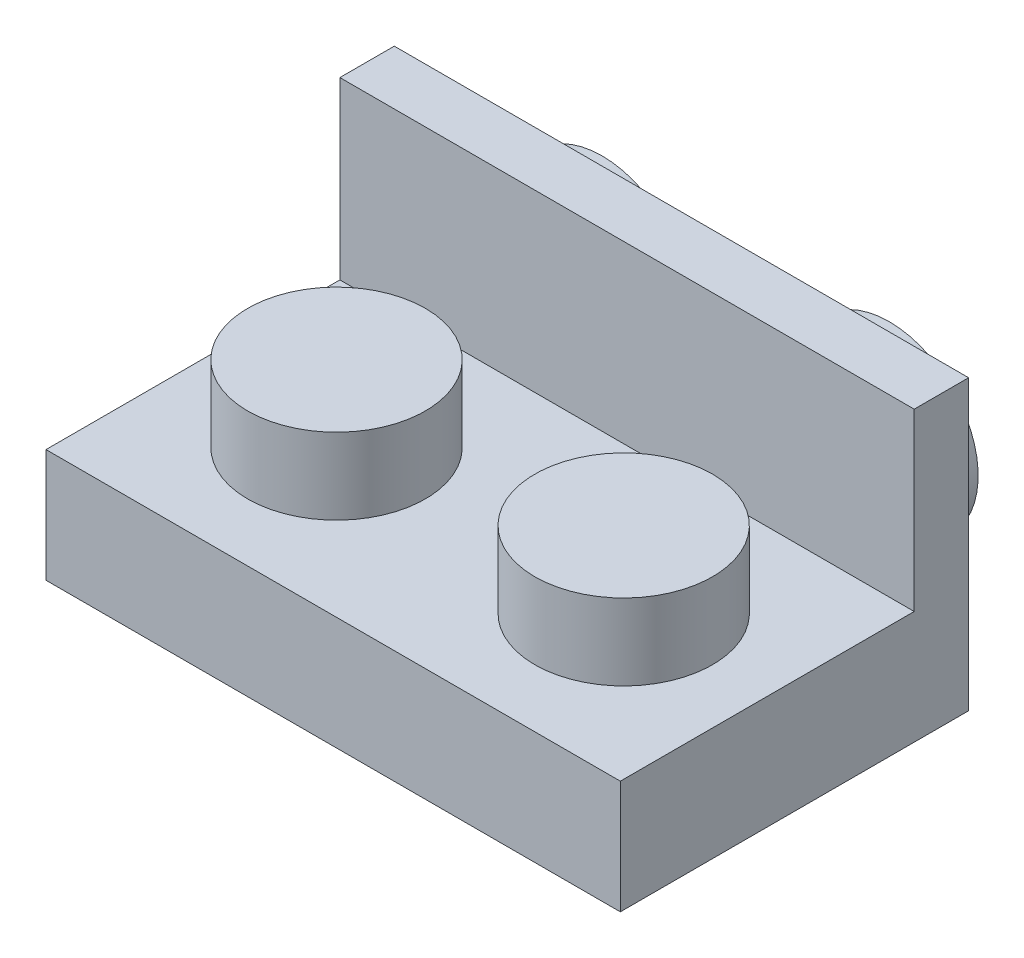
from build123d import *

# Parameters (mm, degrees)
BOSS_EXTRUDE1_DEPTH = 15.83
SKETCH2_R           = 2.45
BOSS_EXTRUDE2_DEPTH = 2.1
SHELL1_START        = -3.12
SHELL1_OUTLINE_W    = 12.83
SHELL1_OUTLINE_H    = 6.6
SHELL1_DEPTH        = 1.62
SHELL1_START_2      = -1.5
SHELL1_2_OUTLINE_R  = 0.95
SHELL1_2_DEPTH      = 2.1
SKETCH3_R           = 2.45
SKETCH3_R_2         = 1.47
SKETCH3_R_3         = 1.51
BOSS_EXTRUDE3_DEPTH = 1.77
SKETCH4_R           = 1.5
SKETCH4_R_2         = 0.66
BOSS_EXTRUDE4_DEPTH = 1.42


# Read off the part's stored shape, not the designer's step: Shell1
with BuildPart() as part:
    # Sketch1 → Boss-Extrude1 (new body)
    with BuildSketch(Plane(origin=(0, 0, 0), x_dir=(0, 0, -1), z_dir=(1, 0, 0))):
        Polygon((0, 0), (0, 4.83), (1.5, 4.83), (1.5, -3.12), (-8.1, -3.12), (-8.1, 0), align=None)
    extrude(amount=-BOSS_EXTRUDE1_DEPTH)

    # Sketch2 → Boss-Extrude2 (add)
    with BuildSketch(Plane(origin=(0, 0, 0), x_dir=(1, 0, 0), z_dir=(0, 1, 0))):
        with Locations(Location((-11.8725, -4.05, 0), (0, 0, 270))):
            Circle(SKETCH2_R)
        with Locations(Location((-3.9575, -4.05, 0), (0, 0, 270))):
            Circle(SKETCH2_R)
    extrude(amount=BOSS_EXTRUDE2_DEPTH)

    # Shell1 outline → Shell1 (cut)
    with BuildSketch(Plane(origin=(0, 0, 0), x_dir=(1, 0, 0), z_dir=(0, 1, 0)).offset(SHELL1_START)):
        with Locations((-7.915, -3.3)):
            Rectangle(SHELL1_OUTLINE_W, SHELL1_OUTLINE_H)
    extrude(amount=SHELL1_DEPTH, mode=Mode.SUBTRACT)

    # Shell1 2 outline → Shell1 2 (cut)
    with BuildSketch(Plane(origin=(0, 0, 0), x_dir=(1, 0, 0), z_dir=(0, 1, 0)).offset(SHELL1_START_2)):
        with Locations((-11.8725, -4.05)):
            Circle(SHELL1_2_OUTLINE_R)
        with Locations((-3.9575, -4.05)):
            Circle(SHELL1_2_OUTLINE_R)
    extrude(amount=SHELL1_2_DEPTH, mode=Mode.SUBTRACT)

    # Sketch3 → Boss-Extrude3 (add)
    # profile 1 of 2: a face of its own
    with BuildSketch(Plane(origin=(0, 0, -1.5), x_dir=(-1, 0, 0), z_dir=(0, 0, -1))):
        with Locations(Location((3.9575, 0.855, 0), (0, 0, 90))):
            Circle(SKETCH3_R)
        with Locations(Location((3.9575, 0.855, 0), (0, 0, 90))):
            Circle(SKETCH3_R_2, mode=Mode.SUBTRACT)
    # profile 2 of 2: a face of its own
    with BuildSketch(Plane(origin=(0, 0, -1.5), x_dir=(-1, 0, 0), z_dir=(0, 0, -1))):
        with Locations(Location((11.8725, 0.855, 0), (0, 0, 90))):
            Circle(SKETCH3_R)
        with Locations(Location((11.8725, 0.855, 0), (0, 0, 90))):
            Circle(SKETCH3_R_3, mode=Mode.SUBTRACT)
    extrude(amount=BOSS_EXTRUDE3_DEPTH)

    # Sketch4 → Boss-Extrude4 (add)
    with BuildSketch(Plane.XZ.offset(1.5)):
        with Locations(Location((-7.915, 3.3, 0), (0, 0, 90))):
            Circle(SKETCH4_R)
        with Locations(Location((-7.915, 3.3, 0), (0, 0, 270))):
            Circle(SKETCH4_R_2, mode=Mode.SUBTRACT)
    extrude(amount=BOSS_EXTRUDE4_DEPTH)


solid = part.part
